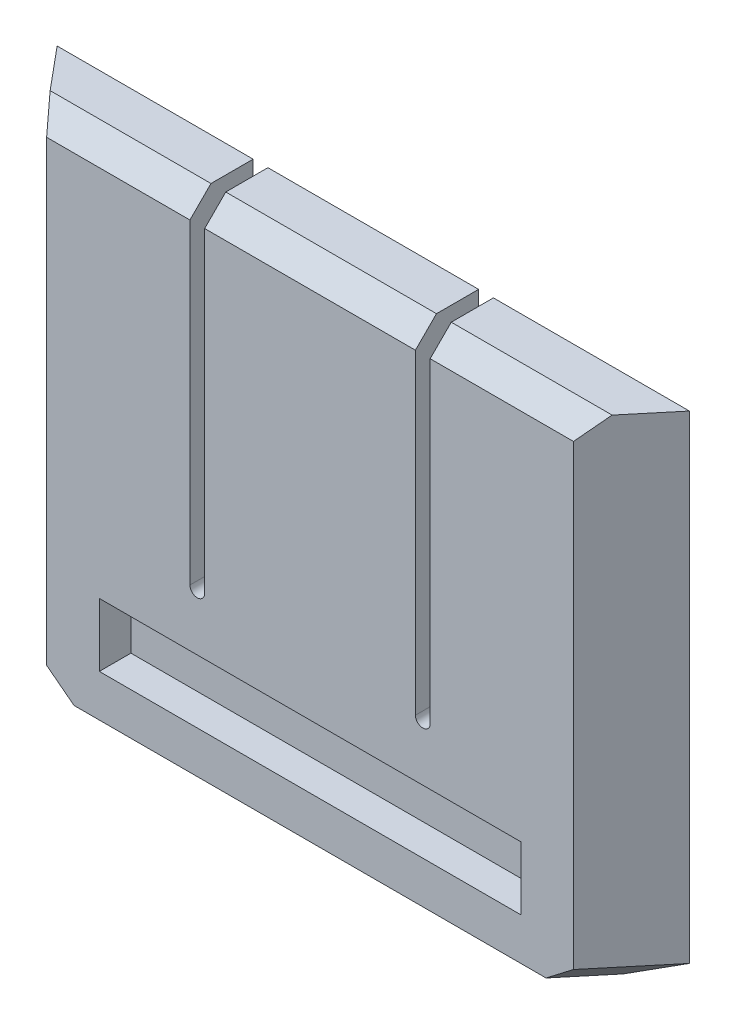
from build123d import *

# Parameters (mm, degrees)
SKETCH1_W           = 25
SKETCH1_H           = 23.7
BOSS_EXTRUDE1_DEPTH = 3
BOSS_EXTRUDE2_DEPTH = 23.7
SKETCH4_W           = 10
SKETCH4_H           = 10
CUT_EXTRUDE1_DEPTH  = 1.5
CUT_EXTRUDE2_DEPTH  = 3
SKETCH6_W           = 10
SKETCH6_H           = 3
BOSS_EXTRUDE3_DEPTH = 1.5
CHAMFER1_SIZE       = 1.5
CHAMFER1_SIZE2      = 2.598076211
SKETCH7_W           = 20
SKETCH7_H           = 3
CUT_EXTRUDE3_DEPTH  = 1.5
FILLET1_R           = 1
SKETCH8_W           = 8
SKETCH8_H           = 2
CUT_EXTRUDE4_DEPTH  = 1
FILLET2_R           = 10
FILLET3_R           = 1
CHAMFER3_SIZE       = 1
CHAMFER4_SIZE       = 1
CHAMFER5_SIZE       = 1
CHAMFER5_SIZE2      = 1.191753593


with BuildPart() as part:
    # Sketch1 → Boss-Extrude1 (new body)
    with BuildSketch(Plane.XY):
        with Locations((12.5, 11.85)):
            Rectangle(SKETCH1_W, SKETCH1_H)
    extrude(amount=BOSS_EXTRUDE1_DEPTH)

    # Sketch2 → Boss-Extrude2 (add)
    with BuildSketch(Plane.XZ):
        Polygon((0, 0), (-2.5, 0), (0, 3), align=None)
        Polygon((25, 0), (27.5, 0), (25, 3), align=None)
    extrude(amount=-BOSS_EXTRUDE2_DEPTH)

    # Sketch4 → Cut-Extrude1 (cut)
    with BuildSketch(Plane(origin=(0, 0, 0), x_dir=(-1, 0, 0), z_dir=(0, 0, -1))):
        with Locations((-12.5, 12.7)):
            Rectangle(SKETCH4_W, SKETCH4_H)
    extrude(amount=-CUT_EXTRUDE1_DEPTH, mode=Mode.SUBTRACT)

    # Sketch5 → Cut-Extrude2 (cut)
    with BuildSketch(Plane(origin=(0, 0, 0), x_dir=(-1, 0, 0), z_dir=(0, 0, -1))):
        with BuildLine():
            Line((-17.5, 7.7), (-17.5, 23.7))
            Line((-17.5, 23.7), (-18.2, 23.7))
            Line((-18.2, 23.7), (-18.2, 7.7))
            ThreePointArc((-18.2, 7.7), (-17.85, 7.35), (-17.5, 7.7))
        make_face()
        with BuildLine():
            Line((-7.5, 7.7), (-7.5, 23.7))
            Line((-7.5, 23.7), (-6.8, 23.7))
            Line((-6.8, 23.7), (-6.8, 7.7))
            ThreePointArc((-6.8, 7.7), (-7.15, 7.35), (-7.5, 7.7))
        make_face()
    extrude(amount=-CUT_EXTRUDE2_DEPTH, mode=Mode.SUBTRACT)

    # Sketch6 → Boss-Extrude3 (add)
    with BuildSketch(Plane(origin=(0, 0, 0), x_dir=(-1, 0, 0), z_dir=(0, 0, -1))):
        with Locations((-12.5, 19.2)):
            Rectangle(SKETCH6_W, SKETCH6_H)
    extrude(amount=BOSS_EXTRUDE3_DEPTH)

    # Chamfer1
    chamfer1_edges = [part.edges().sort_by_distance(p)[0] for p in [
        (12.5, 17.7, -1.5),
    ]]
    chamfer1_side = [part.faces().sort_by_distance(p)[0] for p in [
        (12.5, 17.7, 0),
    ]]
    chamfer(chamfer1_edges, length=CHAMFER1_SIZE, length2=CHAMFER1_SIZE2, reference=chamfer1_side[0])

    # Sketch7 → Cut-Extrude3 (cut)
    with BuildSketch(Plane.XY.offset(3)):
        with Locations((12.5, 3.5)):
            Rectangle(SKETCH7_W, SKETCH7_H)
    extrude(amount=-CUT_EXTRUDE3_DEPTH, mode=Mode.SUBTRACT)

    # Fillet1
    fillet1_edges = [part.edges().sort_by_distance(p)[0] for p in [
        (12.5, 17.7, 1.5),
        (12.5, 7.7, 1.5),
    ]]
    fillet(fillet1_edges, radius=FILLET1_R)

    # Sketch8 → Cut-Extrude4 (cut)
    with BuildSketch(Plane(origin=(0, 0, 0), x_dir=(-1, 0, 0), z_dir=(0, 0, -1))):
        with Locations((-12.5, 21.7)):
            Rectangle(SKETCH8_W, SKETCH8_H)
    extrude(amount=-CUT_EXTRUDE4_DEPTH, mode=Mode.SUBTRACT)

    # Fillet2
    # the kernel refuses this fillet: 10 mm, written as the material it takes off along each edge
    with BuildSketch(Plane(origin=(25, 17.7, 0), x_dir=(0, -0.17402760364384265, 0.9847407746051655), z_dir=(-1, 0, 0))) as fillet2_piece_1_section:
        with BuildLine():
            CenterArc((5.512472708, 8.977269728), FILLET2_R, 221.911963519, 21.948914507)
            Line((-1.929248139, 2.297390175), (-2.673420224, 1.62940222))
            ThreePointArc((-2.673420224, 1.62940222), (-1.730420795, 0.505612375), (-0.765796725, -0.643082713))
            Line((-0.765796725, -0.643082713), (0.174027604, -0.984740775))
            Line((0.174027604, -0.984740775), (0.666397991, -0.897726973))
            Line((0.666397991, -0.897726973), (1.106950238, 0))
        make_face()
    fillet2_piece_1 = extrude(amount=25, mode=Mode.PRIVATE)
    fillet2_piece_1 = split(fillet2_piece_1, bisect_by=Plane(origin=(18.2, 17.7, 0), z_dir=(-1, 0, 0)), keep=Keep.TOP, mode=Mode.PRIVATE)
    fillet2_piece_1 = split(fillet2_piece_1, bisect_by=Plane(origin=(6.8, 17.7, 0), z_dir=(1, 0, 0)), keep=Keep.TOP, mode=Mode.PRIVATE)
    add(fillet2_piece_1, mode=Mode.SUBTRACT)

    # Fillet3
    # the kernel refuses this fillet: 1 mm, written as the material it takes off along each edge
    with BuildSketch(Plane(origin=(5.158770817, 7.7, 0), x_dir=(0, -1, 0), z_dir=(1, 0, 0))) as fillet3_piece_1_section:
        with BuildLine():
            CenterArc((0.936491673, -1), FILLET3_R, 90, 75.522487814)
            Line((-0.031754163, -0.75), (-0.128578747, -0.725))
            ThreePointArc((-0.128578747, -0.725), (-0.1, -0.5), (-0.1, 0))
            Line((-0.1, 0), (0, 0.1))
            Line((0, 0.1), (0.936491673, 0.1))
            Line((0.936491673, 0.1), (0.936491673, 0))
        make_face()
    fillet3_piece_1 = extrude(amount=14.682458366, mode=Mode.PRIVATE)
    fillet3_piece_1 = split(fillet3_piece_1, bisect_by=Plane(origin=(6.8, 7.7, 0), z_dir=(1, 0, 0)), keep=Keep.TOP, mode=Mode.PRIVATE)
    fillet3_piece_1 = split(fillet3_piece_1, bisect_by=Plane(origin=(18.2, 7.7, 0), z_dir=(-1, 0, 0)), keep=Keep.TOP, mode=Mode.PRIVATE)
    add(fillet3_piece_1, mode=Mode.SUBTRACT)

    # Chamfer3
    chamfer3_edges = [part.edges().sort_by_distance(p)[0] for p in [
        (-1.25, 0, 1.5),
        (26.25, 0, 1.5),
        (12.5, 0, 0),
    ]]
    chamfer(chamfer3_edges, length=CHAMFER3_SIZE)

    # Chamfer4
    chamfer4_edges = [part.edges().sort_by_distance(p)[0] for p in [
        (21.6, 23.7, 3),
        (12.5, 23.7, 3),
        (3.4, 23.7, 3),
    ]]
    chamfer(chamfer4_edges, length=CHAMFER4_SIZE)

    # Chamfer5
    chamfer5_edges = [part.edges().sort_by_distance(p)[0] for p in [
        (12.5, 20.7, 1),
    ]]
    chamfer5_side = [part.faces().sort_by_distance(p)[0] for p in [
        (12.5, 20.7, -0.315217391),
    ]]
    chamfer(chamfer5_edges, length=CHAMFER5_SIZE, length2=CHAMFER5_SIZE2, reference=chamfer5_side[0])


solid = part.part
